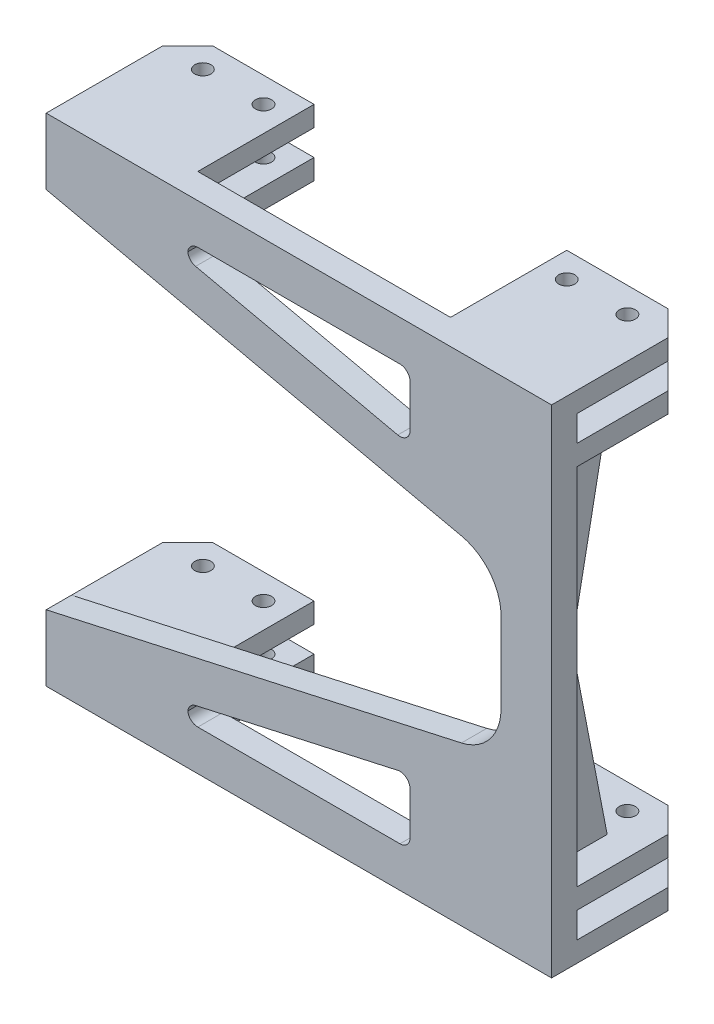
from build123d import *

# Parameters (mm, degrees)
SKETCH_1_W          = 100
SKETCH_1_H          = 98.2
EXTRUDE_1_DEPTH     = 5
SKETCH_2_W          = 25
SKETCH_2_H          = 4
EXTRUDE_2_DEPTH     = 23
CHAMFER_1_SIZE      = 5
SKETCH_3_R          = 1.6
CUT_EXTRUDE_1_DEPTH = 100
SKETCH_5_W          = 90
SKETCH_5_H          = 72
CUT_EXTRUDE_2_DEPTH = 10
EXTRUDE_3_DEPTH     = 5
FILLET_1_R          = 10
EXTRUDE_4_DEPTH     = 4
CUT_EXTRUDE_3_DEPTH = 10
FILLET1_R           = 10
FILLET2_R           = 2


with BuildPart() as part:
    # 草图1 → 凸台-拉伸1 (new body)
    with BuildSketch(Plane.XY):
        with Locations((-210.886237356, -45)):
            Rectangle(SKETCH_1_W, SKETCH_1_H)
        with BuildLine():
            ThreePointArc((-245.131057565, -22.358440495), (-248.492232664, -20.607289414), (-250.886237356, -23.545446947))
            Line((-250.886237356, -23.545446947), (-250.886237356, -78))
            ThreePointArc((-250.886237356, -78), (-250.0075577, -80.121320344), (-247.886237356, -81))
            Line((-247.886237356, -81), (-224.42573361, -81))
            ThreePointArc((-224.42573361, -81), (-221.919639103, -79.649087724), (-221.670553819, -76.812993548))
            Line((-221.670553819, -76.812993548), (-245.131057565, -22.358440495))
        make_face(mode=Mode.SUBTRACT)
        with BuildLine():
            ThreePointArc((-191.655684006, -33.128922342), (-194.657829236, -31.333405344), (-197.320051564, -33.602618764))
            Line((-197.320051564, -33.602618764), (-208.123721184, -77.279649032))
            ThreePointArc((-208.123721184, -77.279649032), (-207.573803103, -79.849181859), (-205.211489311, -81))
            Line((-205.211489311, -81), (-175.458011282, -81))
            ThreePointArc((-175.458011282, -81), (-172.949810516, -79.645882413), (-172.705875596, -76.805952611))
            Line((-172.705875596, -76.805952611), (-191.655684006, -33.128922342))
        make_face(mode=Mode.SUBTRACT)
        with BuildLine():
            ThreePointArc((-176.638373042, -42.617387799), (-173.276486201, -44.360720795), (-170.886237356, -41.42334041))
            Line((-170.886237356, -41.42334041), (-170.886237356, -12))
            ThreePointArc((-170.886237356, -12), (-171.764917013, -9.878679656), (-173.886237356, -9))
            Line((-173.886237356, -9), (-186.651909841, -9))
            ThreePointArc((-186.651909841, -9), (-189.160110607, -10.354117587), (-189.404045527, -13.194047389))
            Line((-189.404045527, -13.194047389), (-176.638373042, -42.617387799))
        make_face(mode=Mode.SUBTRACT)
        with BuildLine():
            Line((-203.040454286, -12.717792993), (-213.768880163, -56.2546336))
            ThreePointArc((-213.768880163, -56.2546336), (-216.43424337, -58.526613784), (-219.43692336, -56.723847059))
            Line((-219.43692336, -56.723847059), (-238.193779397, -13.187006452))
            ThreePointArc((-238.193779397, -13.187006452), (-237.944694112, -10.350912276), (-235.438599605, -9))
            Line((-235.438599605, -9), (-205.953317692, -9))
            ThreePointArc((-205.953317692, -9), (-203.591816159, -10.149780956), (-203.040454286, -12.717792993))
        make_face(mode=Mode.SUBTRACT)
    extrude(amount=EXTRUDE_1_DEPTH)

    # 草图2 → 凸台-拉伸2 (add)
    with BuildSketch(Plane(origin=(0, 0, 0), x_dir=(-1, 0, 0), z_dir=(0, 0, -1))):
        with Locations((248.386237356, 2.1)):
            Rectangle(SKETCH_2_W, SKETCH_2_H)
        with Locations((248.386237356, -7)):
            Rectangle(SKETCH_2_W, SKETCH_2_H)
        with Locations((173.386237356, -7)):
            Rectangle(SKETCH_2_W, SKETCH_2_H)
        with Locations((173.386237356, 2.1)):
            Rectangle(SKETCH_2_W, SKETCH_2_H)
        with Locations((173.386237356, -92.1)):
            Rectangle(SKETCH_2_W, SKETCH_2_H)
        with Locations((173.386237356, -83)):
            Rectangle(SKETCH_2_W, SKETCH_2_H)
        with Locations((248.386237356, -83)):
            Rectangle(SKETCH_2_W, SKETCH_2_H)
        with Locations((248.386237356, -92.1)):
            Rectangle(SKETCH_2_W, SKETCH_2_H)
    extrude(amount=EXTRUDE_2_DEPTH)

    # 倒角1
    chamfer_1_edges = [part.edges().sort_by_distance(p)[0] for p in [
        (-160.886237356, -7, -23),
        (-160.886237356, 2.1, -23),
        (-160.886237356, -92.1, -23),
        (-160.886237356, -83, -23),
        (-260.886237356, -83, -23),
        (-260.886237356, -92.1, -23),
        (-260.886237356, 2.1, -23),
        (-260.886237356, -7, -23),
    ]]
    chamfer(chamfer_1_edges, length=CHAMFER_1_SIZE)

    # 草图3 → 切除-拉伸1 (cut)
    with BuildSketch(Plane(origin=(0, 4.1, 0), x_dir=(1, 0, 0), z_dir=(0, 1, 0))):
        with Locations(Location((-252.886237356, 18, 0), (0, 0, 270))):
            Circle(SKETCH_3_R)
        with Locations(Location((-240.886237356, 18, 0), (0, 0, 270))):
            Circle(SKETCH_3_R)
        with Locations(Location((-180.886237356, 18, 0), (0, 0, 180))):
            Circle(SKETCH_3_R)
        with Locations(Location((-168.886237356, 18, 0), (0, 0, 180))):
            Circle(SKETCH_3_R)
    extrude(amount=-CUT_EXTRUDE_1_DEPTH, mode=Mode.SUBTRACT)

    # 草图5 → 切除-拉伸2 (cut)
    with BuildSketch(Plane(origin=(0, 0, 0), x_dir=(-1, 0, 0), z_dir=(0, 0, -1))):
        with Locations((215.886237356, -45)):
            Rectangle(SKETCH_5_W, SKETCH_5_H)
    extrude(amount=-CUT_EXTRUDE_2_DEPTH, mode=Mode.SUBTRACT)

    # 草图6 → 凸台-拉伸3 (add)
    with BuildSketch(Plane(origin=(0, 0, 0), x_dir=(-1, 0, 0), z_dir=(0, 0, -1))):
        Polygon((170.886237356, -29), (260.886237356, -9), (170.886237356, -9), align=None)
        Polygon((170.886237356, -61), (170.886237356, -81), (260.886237356, -81), align=None)
    extrude(amount=-EXTRUDE_3_DEPTH)

    # 圆角1
    fillet_1_edges = [part.edges().sort_by_distance(p)[0] for p in [
        (-170.886237356, -29, 2.5),
        (-170.886237356, -61, 2.5),
    ]]
    fillet(fillet_1_edges, radius=FILLET_1_R)

    # 草图7 → 凸台-拉伸4 (add)
    with BuildSketch(Plane(origin=(-170.886237356, 0, 0), x_dir=(0, 0, -1), z_dir=(1, 0, 0))):
        Polygon((12, -9), (5, -45), (12, -81), (0, -81), (0, -9), align=None)
    extrude(amount=EXTRUDE_4_DEPTH)

    # 草图8 → 切除-拉伸3 (cut)
    with BuildSketch(Plane(origin=(0, 0, 0), x_dir=(-1, 0, 0), z_dir=(0, 0, -1))):
        Polygon((188.886237356, -16.804849371), (232.886237356, -7.027071594), (232.886237356, -3.9), (188.886237356, -3.9), align=None)
        Polygon((188.886237356, -86.1), (188.886237356, -73.195150629), (232.886237356, -82.972928406), (232.886237356, -86.1), align=None)
    extrude(amount=-CUT_EXTRUDE_3_DEPTH, mode=Mode.SUBTRACT)

    # Fillet1
    fillet1_edges = [part.edges().sort_by_distance(p)[0] for p in [
        (-168.886237356, -45, -5),
    ]]
    fillet(fillet1_edges, radius=FILLET1_R)

    # Fillet2
    # the kernel refuses this fillet: 2 mm, written as the material it adds along each edge
    with BuildSketch(Plane(origin=(-188.886237356, -16.804849371, 0), x_dir=(-0.9761870601839525, 0.2169304578186577, 0), z_dir=(0, 0, 1))) as fillet2_piece_1:
        with BuildLine():
            CenterArc((FILLET2_R * 1.24661605081, -FILLET2_R), FILLET2_R, 90, 102.528807709)
            Line((FILLET2_R * 0.270428990626, -FILLET2_R * 1.21693045782), (0, 0))
            Line((0, 0), (FILLET2_R * 1.24661605081, 0))
        make_face()
    extrude(amount=5)
    with BuildSketch(Plane(origin=(-232.886237356, -7.027071594, 0), x_dir=(0.9761870601839526, -0.21693045781865725, 0), z_dir=(0, 0, 1)), Plane(origin=(-232.886237356, -82.972928406, 0), x_dir=(0, -1, 0), z_dir=(0, 0, 1))) as fillet2_piece_2:
        with BuildLine():
            CenterArc((FILLET2_R * 0.802171606366, FILLET2_R), FILLET2_R, 192.528807709, 77.471192291)
            Line((-FILLET2_R * 0.174015453818, FILLET2_R * 0.783069542181), (0, 0))
            Line((0, 0), (FILLET2_R * 0.802171606366, 0))
        make_face()
    extrude(amount=5)
    with BuildSketch(Plane(origin=(-232.886237356, -3.9, 0), x_dir=(0, -1, 0), z_dir=(0, 0, 1)), Plane(origin=(-188.886237356, -3.9, 0), x_dir=(-1, 0, 0), z_dir=(0, 0, 1)), Plane(origin=(-232.886237356, -86.1, 0), x_dir=(1, 0, 0), z_dir=(0, 0, 1))) as fillet2_piece_3:
        with BuildLine():
            CenterArc((FILLET2_R, FILLET2_R), FILLET2_R, 180, 90)
            Line((0, FILLET2_R), (0, 0))
            Line((0, 0), (FILLET2_R, 0))
        make_face()
    extrude(amount=5)
    with BuildSketch(Plane(origin=(-188.886237356, -73.195150629, 0), x_dir=(-0.9761870601839525, -0.21693045781865739, 0), z_dir=(0, 0, 1))) as fillet2_piece_4:
        with BuildLine():
            CenterArc((FILLET2_R * 1.24661605081, FILLET2_R), FILLET2_R, 167.471192291, 102.528807709)
            Line((FILLET2_R * 0.270428990626, FILLET2_R * 1.21693045782), (0, 0))
            Line((0, 0), (FILLET2_R * 1.24661605081, 0))
        make_face()
    extrude(amount=5)
    with BuildSketch(Plane(origin=(-188.886237356, -86.1, 0), x_dir=(-1, 0, 0), z_dir=(0, 0, 1))) as fillet2_piece_5:
        with BuildLine():
            CenterArc((FILLET2_R, -FILLET2_R), FILLET2_R, 90, 90)
            Line((0, -FILLET2_R), (0, 0))
            Line((0, 0), (FILLET2_R, 0))
        make_face()
    extrude(amount=5)


solid = part.part
